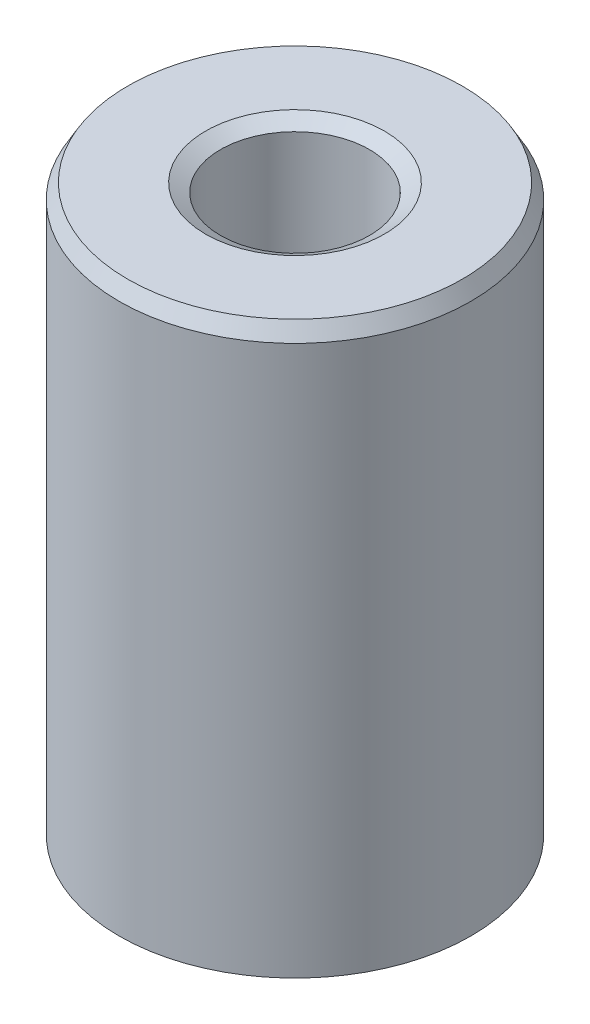
from build123d import *
from OCP.BRepFilletAPI import BRepFilletAPI_MakeChamfer

# Parameters (mm, degrees)
SKETCH1_R           = 17.5
BOSS_EXTRUDE1_DEPTH = 57.015734079
SKETCH2_R           = 7.411444913
CUT_EXTRUDE1_DEPTH  = 63.155401475
CHAMFER1_SIZE       = 1.479774418
CHAMFER1_SIZE2      = 0.854348158


with BuildPart() as part:
    # Sketch1 → Boss-Extrude1 (new body)
    with BuildSketch(Plane(origin=(0, 0, 0), x_dir=(1, 0, 0), z_dir=(0, 1, 0))):
        Circle(SKETCH1_R)
    extrude(amount=BOSS_EXTRUDE1_DEPTH)

    # Sketch2 → Cut-Extrude1 (cut, through all)
    with BuildSketch(Plane(origin=(0, 0, 0), x_dir=(1, 0, 0), z_dir=(0, 1, 0))):
        Circle(SKETCH2_R)
    extrude(amount=CUT_EXTRUDE1_DEPTH, mode=Mode.SUBTRACT)

    # Chamfer1: one chamfer whose edges measure the first distance from different faces: ONE call of the kernel's chamfer builder (chamfer() names one face for all edges)
    chamfer1_edges_1 = [part.edges().sort_by_distance(p)[0] for p in [
        (-7.411444913, 57.015734079, 0),
    ]]
    chamfer1_side_1 = [part.faces().sort_by_distance(p)[0] for p in [
        (-17.005025253, 57.015734079, 0),
    ]]
    chamfer1_edges_2 = [part.edges().sort_by_distance(p)[0] for p in [
        (-7.411444913, 0, 0),
    ]]
    chamfer1_side_2 = [part.faces().sort_by_distance(p)[0] for p in [
        (-7.411444913, 28.507867039, 0),
    ]]
    chamfer1_edges_3 = [part.edges().sort_by_distance(p)[0] for p in [
        (-17.5, 0, 0),
    ]]
    chamfer1_side_3 = [part.faces().sort_by_distance(p)[0] for p in [
        (-17.005025253, 0, 0),
    ]]
    chamfer1_edges_4 = [part.edges().sort_by_distance(p)[0] for p in [
        (-17.5, 57.015734079, 0),
    ]]
    chamfer1_side_4 = [part.faces().sort_by_distance(p)[0] for p in [
        (-17.5, 28.507867039, 0),
    ]]
    chamfer1 = BRepFilletAPI_MakeChamfer(part.part.solid().wrapped)
    for e in chamfer1_edges_1:
        chamfer1.Add(CHAMFER1_SIZE, CHAMFER1_SIZE2, e.wrapped, chamfer1_side_1[0].wrapped)  # the first distance lies on this face
    for e in chamfer1_edges_2:
        chamfer1.Add(CHAMFER1_SIZE, CHAMFER1_SIZE2, e.wrapped, chamfer1_side_2[0].wrapped)  # the first distance lies on this face
    for e in chamfer1_edges_3:
        chamfer1.Add(CHAMFER1_SIZE, CHAMFER1_SIZE2, e.wrapped, chamfer1_side_3[0].wrapped)  # the first distance lies on this face
    for e in chamfer1_edges_4:
        chamfer1.Add(CHAMFER1_SIZE, CHAMFER1_SIZE2, e.wrapped, chamfer1_side_4[0].wrapped)  # the first distance lies on this face
    add(Compound.cast(chamfer1.Shape()), mode=Mode.REPLACE)


solid = part.part
